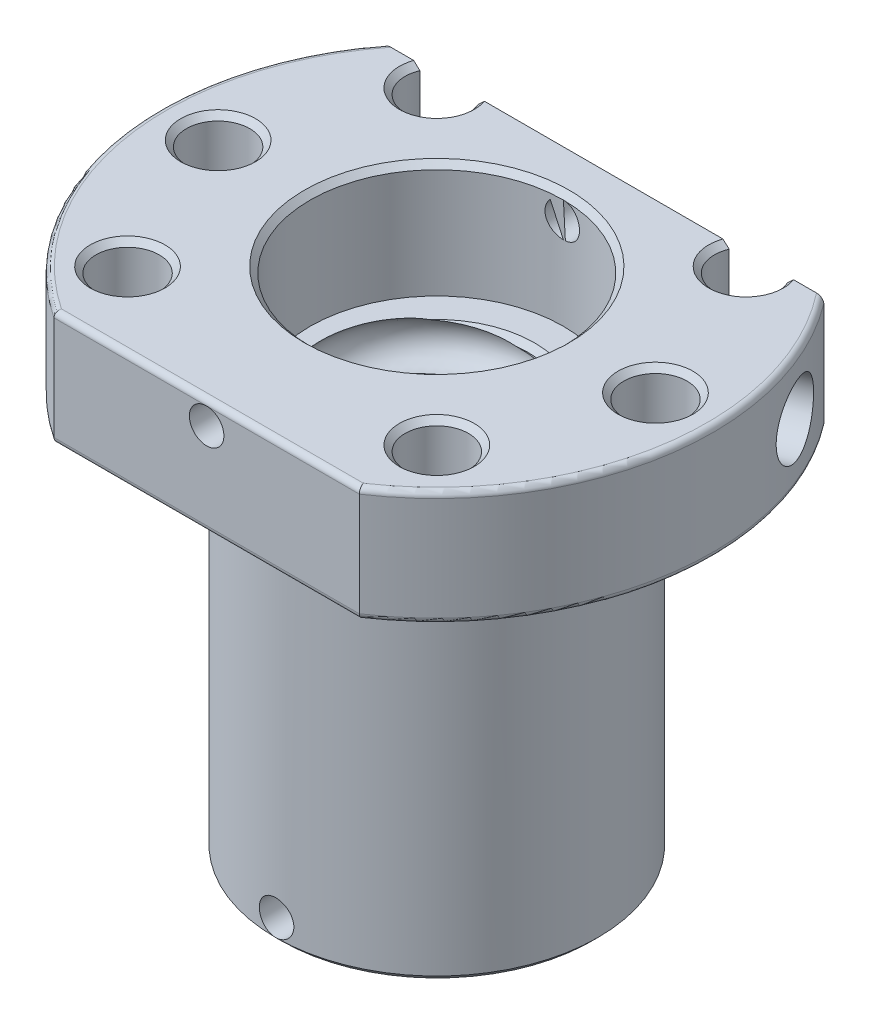
from build123d import *

# Parameters (mm, degrees)
CUT_EXTRUDE2_REACH      = 57.57
CUT_EXTRUDE3_REACH      = 55.963
SKETCH4_R               = 2.75
CHAMFER1_SIZE           = 0.5
CUT_EXTRUDE4_REACH      = 72.14
CUT_EXTRUDE4_END_RADIUS = 11
SKETCH5_R               = 2.5
SKETCH6_R               = 3
CUT_EXTRUDE5_DEPTH      = 10
FILLET1_R               = 0.5
SKETCH7_R               = 1.5
CUT_EXTRUDE6_DEPTH      = 65.124878267
SKETCH8_R               = 1.5
CUT_EXTRUDE7_DEPTH      = 28
CUT_SWEEP1_PITCH        = 5
SKETCH11_W              = 48
SKETCH11_H              = 5.6
CUT_EXTRUDE8_DEPTH      = 54.962950334


with BuildPart() as part:
    # Sketch1 → Revolve1 (revolve)
    with BuildSketch(Plane(origin=(0, 0, 0), x_dir=(0, 0, -1), z_dir=(1, 0, 0))):
        Polygon((-11, 0), (-24, 0), (-24, -10), (-14, -10), (-14, -44), (-11, -44), (-11, -34), (-8, -34), (-8, -10), (-11, -10), align=None)
    revolve(axis=Axis((0, 0, 0), (0, -1, 0)))

    # Sketch2 → Cut-Extrude2 (cut, up to next)
    with BuildSketch(Plane(origin=(0, 0, 0), x_dir=(1, 0, 0), z_dir=(0, 1, 0)), mode=Mode.PRIVATE) as cut_extrude2_sk1:
        with BuildLine():
            Line((-13.266499161, 20), (13.266499161, 20))
            ThreePointArc((13.266499161, 20), (0, 24), (-13.266499161, 20))
        make_face()
    cut_extrude2_tool1 = extrude(cut_extrude2_sk1.sketch, amount=-CUT_EXTRUDE2_REACH, mode=Mode.PRIVATE) & part.part
    # Sketch2 → Cut-Extrude2 (cut, up to next)
    with BuildSketch(Plane(origin=(0, 0, 0), x_dir=(1, 0, 0), z_dir=(0, 1, 0)), mode=Mode.PRIVATE) as cut_extrude2_sk2:
        with BuildLine():
            Line((-13.266499161, -20), (13.266499161, -20))
            ThreePointArc((13.266499161, -20), (0, -24), (-13.266499161, -20))
        make_face()
    cut_extrude2_tool2 = extrude(cut_extrude2_sk2.sketch, amount=-CUT_EXTRUDE2_REACH, mode=Mode.PRIVATE) & part.part
    add(cut_extrude2_tool1.solids().sort_by_distance((0, 0, -21.612009))[0], mode=Mode.SUBTRACT)
    add(cut_extrude2_tool2.solids().sort_by_distance((0, 0, 21.612009))[0], mode=Mode.SUBTRACT)

    # Sketch4 → Cut-Extrude3 (cut, up to next)
    with BuildSketch(Plane(origin=(0, 0, 0), x_dir=(1, 0, 0), z_dir=(0, 1, 0)), mode=Mode.PRIVATE) as cut_extrude3_sk1:
        with Locations(Location((-19, 0, 0), (0, 0, 270))):
            Circle(SKETCH4_R)
    cut_extrude3_tool1 = extrude(cut_extrude3_sk1.sketch, amount=-CUT_EXTRUDE3_REACH, mode=Mode.PRIVATE) & part.part
    # Sketch4 → Cut-Extrude3 (cut, up to next)
    with BuildSketch(Plane(origin=(0, 0, 0), x_dir=(1, 0, 0), z_dir=(0, 1, 0)), mode=Mode.PRIVATE) as cut_extrude3_sk2:
        with Locations(Location((-13.435028843, -13.435028843, 0), (0, 0, 270))):
            Circle(SKETCH4_R)
    cut_extrude3_tool2 = extrude(cut_extrude3_sk2.sketch, amount=-CUT_EXTRUDE3_REACH, mode=Mode.PRIVATE) & part.part
    # Sketch4 → Cut-Extrude3 (cut, up to next)
    with BuildSketch(Plane(origin=(0, 0, 0), x_dir=(1, 0, 0), z_dir=(0, 1, 0)), mode=Mode.PRIVATE) as cut_extrude3_sk3:
        with Locations(Location((-13.435028843, 13.435028843, 0), (0, 0, 90))):
            Circle(SKETCH4_R)
    cut_extrude3_tool3 = extrude(cut_extrude3_sk3.sketch, amount=-CUT_EXTRUDE3_REACH, mode=Mode.PRIVATE) & part.part
    # Sketch4 → Cut-Extrude3 (cut, up to next)
    with BuildSketch(Plane(origin=(0, 0, 0), x_dir=(1, 0, 0), z_dir=(0, 1, 0)), mode=Mode.PRIVATE) as cut_extrude3_sk4:
        with Locations(Location((13.435028843, -13.435028843, 0), (0, 0, 90))):
            Circle(SKETCH4_R)
    cut_extrude3_tool4 = extrude(cut_extrude3_sk4.sketch, amount=-CUT_EXTRUDE3_REACH, mode=Mode.PRIVATE) & part.part
    # Sketch4 → Cut-Extrude3 (cut, up to next)
    with BuildSketch(Plane(origin=(0, 0, 0), x_dir=(1, 0, 0), z_dir=(0, 1, 0)), mode=Mode.PRIVATE) as cut_extrude3_sk5:
        with Locations(Location((19, 0, 0), (0, 0, 90))):
            Circle(SKETCH4_R)
    cut_extrude3_tool5 = extrude(cut_extrude3_sk5.sketch, amount=-CUT_EXTRUDE3_REACH, mode=Mode.PRIVATE) & part.part
    # Sketch4 → Cut-Extrude3 (cut, up to next)
    with BuildSketch(Plane(origin=(0, 0, 0), x_dir=(1, 0, 0), z_dir=(0, 1, 0)), mode=Mode.PRIVATE) as cut_extrude3_sk6:
        with Locations(Location((13.435028843, 13.435028843, 0), (0, 0, 270))):
            Circle(SKETCH4_R)
    cut_extrude3_tool6 = extrude(cut_extrude3_sk6.sketch, amount=-CUT_EXTRUDE3_REACH, mode=Mode.PRIVATE) & part.part
    add(cut_extrude3_tool1.solids().sort_by_distance((-19, 0, 0))[0], mode=Mode.SUBTRACT)
    add(cut_extrude3_tool2.solids().sort_by_distance((-13.435029, 0, 13.435029))[0], mode=Mode.SUBTRACT)
    add(cut_extrude3_tool3.solids().sort_by_distance((-13.435029, 0, -13.435029))[0], mode=Mode.SUBTRACT)
    add(cut_extrude3_tool4.solids().sort_by_distance((13.435029, 0, 13.435029))[0], mode=Mode.SUBTRACT)
    add(cut_extrude3_tool5.solids().sort_by_distance((19, 0, 0))[0], mode=Mode.SUBTRACT)
    add(cut_extrude3_tool6.solids().sort_by_distance((13.435029, 0, -13.435029))[0], mode=Mode.SUBTRACT)

    # Chamfer1
    chamfer1_edges = [part.edges().sort_by_distance(p)[0] for p in [
        (0, -44, -14),
        (-19, -10, -2.75),
        (-19, 0, -2.75),
        (-13.435028843, -10, 10.685028843),
        (-13.435028843, 0, 10.685028843),
        (-13.435028843, -10, -10.685028843),
        (-13.435028843, 0, -10.685028843),
        (13.435028843, -10, 16.185028843),
        (13.435028843, 0, 16.185028843),
        (19, -10, 2.75),
        (19, 0, 2.75),
        (13.435028843, -10, -16.185028843),
        (13.435028843, 0, -16.185028843),
        (0, 0, -11),
        (0, -10, -8),
        (0, -34, -8),
        (0, -44, -11),
    ]]
    chamfer(chamfer1_edges, length=CHAMFER1_SIZE)

    # Cut-Extrude4: up to this cylinder (the profile starts outside it)
    cut_extrude4_end = Plane(origin=(0, -5.000195, 0), z_dir=(0, 1, 0)) * Cylinder(CUT_EXTRUDE4_END_RADIUS, 167.28, mode=Mode.PRIVATE)
    # Sketch5 → Cut-Extrude4 (cut, up to the surface)
    with BuildSketch(Plane(origin=(22.17310878, 0, -9.184402377), x_dir=(-0.38268343236508734, 0, -0.9238795325112877), z_dir=(0.9238795325112877, 0, -0.38268343236508734)), mode=Mode.PRIVATE) as cut_extrude4_sk1:
        with Locations((0, -5.000195071)):
            Circle(SKETCH5_R)
    cut_extrude4_tool1 = extrude(cut_extrude4_sk1.sketch, amount=-CUT_EXTRUDE4_REACH, mode=Mode.PRIVATE) - cut_extrude4_end
    add(cut_extrude4_tool1.solids().sort_by_distance((22.173109, -5.000195, -9.184402))[0], mode=Mode.SUBTRACT)

    # Sketch6 → Cut-Extrude5 (cut)
    with BuildSketch(Plane(origin=(22.17310878, 0, -9.184402377), x_dir=(-0.38268343236508734, 0, -0.9238795325112877), z_dir=(0.9238795325112877, 0, -0.38268343236508734))):
        with Locations((0, -5.000195071)):
            Circle(SKETCH6_R)
    extrude(amount=-CUT_EXTRUDE5_DEPTH, mode=Mode.SUBTRACT)

    # Fillet1
    fillet1_edges = [part.edges().sort_by_distance(p)[0] for p in [
        (0, -10, -14),
        (24, -10, 0),
        (0, -10, 20),
        (0, 0, 20),
        (-24, 0, 0),
        (-24, -10, 0),
        (0, -10, -20),
        (0, 0, -20),
        (24, 0, 0),
    ]]
    fillet(fillet1_edges, radius=FILLET1_R)

    # Sketch7 → Cut-Extrude6 (cut, through all)
    with BuildSketch(Plane.XY.offset(20)):
        with Locations(Location((0, -2, 0), (0, 0, 90))):
            Circle(SKETCH7_R)
    extrude(amount=-CUT_EXTRUDE6_DEPTH, mode=Mode.SUBTRACT)

    # Sketch8 → Cut-Extrude7 (cut)
    with BuildSketch(Plane.XY.offset(14)):
        with Locations(Location((0, -42, 0), (0, 0, 270))):
            Circle(SKETCH8_R)
    extrude(amount=-CUT_EXTRUDE7_DEPTH, mode=Mode.SUBTRACT)

    # Cut-Sweep1: the profile of Sketch10 screwed along a right-hand helix of 8.8 turns, 12 arcs to a turn; built about Z, then put on its axis
    cut_sweep1_z = Axis((0, 0, 0), (0, 0, 1))
    cut_sweep1_corners = [(6.1, 0, 0), (8, 0, -1.9), (9.9, 0, 0), (8, 0, 1.9)]
    with BuildLine(mode=Mode.PRIVATE) as cut_sweep1_profile:
        ThreePointArc((6.1, 0, 0), (6.656497116, 0, -1.343502884), (8, 0, -1.9))
        ThreePointArc((8, 0, -1.9), (9.343502884, 0, -1.343502884), (9.9, 0, 0))
        ThreePointArc((9.9, 0, 0), (9.343502884, 0, 1.343502884), (8, 0, 1.9))
        ThreePointArc((8, 0, 1.9), (6.656497116, 0, 1.343502884), (6.1, 0, 0))
    cut_sweep1_cap = Face(cut_sweep1_profile.wire())
    cut_sweep1_arcs = [((6.1, 0, 0), (6.1, 0, -1.9), (8, 0, -1.9), (1, 0.7071067811865476, 1)), ((8, 0, -1.9), (9.9, 0, -1.9), (9.9, 0, 0), (1, 0.7071067811865476, 1)), ((9.9, 0, 0), (9.9, 0, 1.9), (8, 0, 1.9), (1, 0.7071067811865476, 1)), ((8, 0, 1.9), (6.1, 0, 1.9), (6.1, 0, 0), (1, 0.7071067811865476, 1))]  # start, shoulder, end, weights
    cut_sweep1_turn_angles = [0, 15, 30, 45, 60, 75, 90, 105, 120, 135, 150, 165, 180, 195, 210, 225, 240, 255, 270, 285, 300, 315, 330, 345, 360]
    cut_sweep1_turn_weights = [1, 0.9659258262890683, 1, 0.9659258262890683, 1, 0.9659258262890683, 1, 0.9659258262890683, 1, 0.9659258262890683, 1, 0.9659258262890683, 1, 0.9659258262890683, 1, 0.9659258262890683, 1, 0.9659258262890683, 1, 0.9659258262890683, 1, 0.9659258262890683, 1, 0.9659258262890683, 1]
    cut_sweep1_turn_sides = [Face.make_bezier_surface([[Vector(p[j][0], p[j][1], 0).rotate(cut_sweep1_z, cut_sweep1_turn_angles[2 * i + k]) / cut_sweep1_turn_weights[2 * i + k] + Vector(0, 0, p[j][2] + CUT_SWEEP1_PITCH * cut_sweep1_turn_angles[2 * i + k] / 360) for k in range(3)] for j in range(3)], [[p[3][j] * cut_sweep1_turn_weights[2 * i + k] for k in range(3)] for j in range(3)]) for p in cut_sweep1_arcs for i in range(12)]
    cut_sweep1_last_angles = [2880, 2895, 2910, 2925, 2940, 2955, 2970, 2985, 3000, 3015, 3030, 3045, 3060, 3075, 3090, 3105, 3120, 3135, 3150, 3159, 3168]
    cut_sweep1_last_weights = [1, 0.9659258262890683, 1, 0.9659258262890683, 1, 0.9659258262890683, 1, 0.9659258262890683, 1, 0.9659258262890683, 1, 0.9659258262890683, 1, 0.9659258262890683, 1, 0.9659258262890683, 1, 0.9659258262890683, 1, 0.9876883405951141, 1]
    cut_sweep1_last_sides = [Face.make_bezier_surface([[Vector(p[j][0], p[j][1], 0).rotate(cut_sweep1_z, cut_sweep1_last_angles[2 * i + k]) / cut_sweep1_last_weights[2 * i + k] + Vector(0, 0, p[j][2] + CUT_SWEEP1_PITCH * cut_sweep1_last_angles[2 * i + k] / 360) for k in range(3)] for j in range(3)], [[p[3][j] * cut_sweep1_last_weights[2 * i + k] for k in range(3)] for j in range(3)]) for p in cut_sweep1_arcs for i in range(10)]
    cut_sweep1 = Plane(origin=(0, 0, 0), x_dir=(0, 0, 1), z_dir=(0, -1, 0)) * Solid(Shell([*[p.moved(Location((0, 0, CUT_SWEEP1_PITCH * i))) for i in range(8) for p in cut_sweep1_turn_sides], *cut_sweep1_last_sides, cut_sweep1_cap, cut_sweep1_cap.rotate(cut_sweep1_z, 3168).moved(Location((0, 0, CUT_SWEEP1_PITCH * 3168 / 360)))]))
    add(cut_sweep1, mode=Mode.SUBTRACT)

    # Sketch11 → Cut-Extrude8 (cut, through all)
    with BuildSketch(Plane(origin=(0, 0, 0), x_dir=(1, 0, 0), z_dir=(0, 1, 0))):
        with Locations((0, 17.3)):
            Rectangle(SKETCH11_W, SKETCH11_H)
    extrude(amount=-CUT_EXTRUDE8_DEPTH, mode=Mode.SUBTRACT)


solid = part.part
